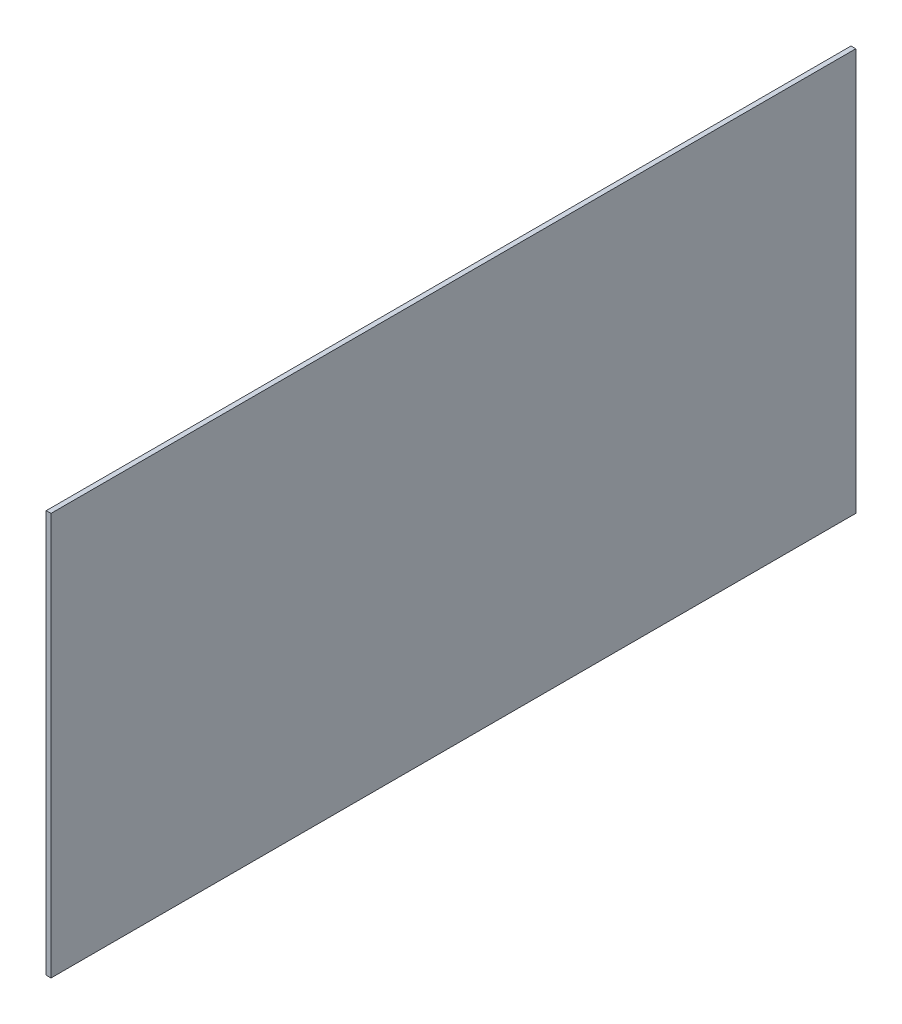
from build123d import *

# Parameters (mm, degrees)
SKETCH1_W           = 266.7
SKETCH1_H           = 133.35
BOSS_EXTRUDE1_DEPTH = 1.5875


with BuildPart() as part:
    # Sketch1 → Boss-Extrude1 (new body)
    with BuildSketch(Plane(origin=(0, 0, 0), x_dir=(0, 0, -1), z_dir=(1, 0, 0))):
        with Locations((133.35, 66.675)):
            Rectangle(SKETCH1_W, SKETCH1_H)
    extrude(amount=BOSS_EXTRUDE1_DEPTH)


solid = part.part
